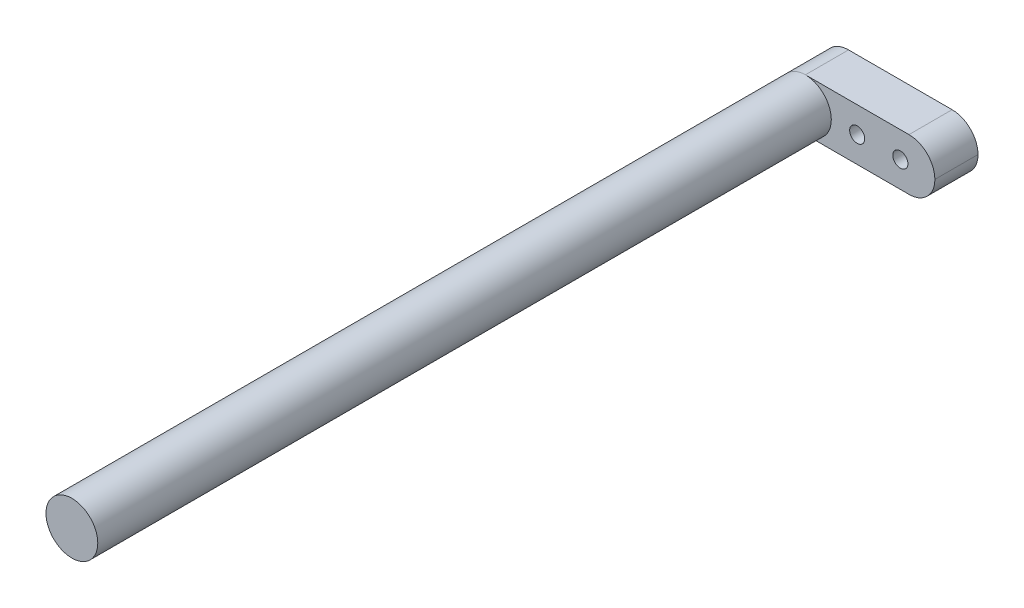
from build123d import *

# Parameters (mm, degrees)
SKETCH1_W           = 36
SKETCH1_H           = 12
BOSS_EXTRUDE1_DEPTH = 10
SKETCH2_R           = 6
BOSS_EXTRUDE2_DEPTH = 170
CUT_EXTRUDE4_REACH  = 184.748
SKETCH7_R           = 1.75
FILLET1_R           = 6


with BuildPart() as part:
    # Sketch1 → Boss-Extrude1 (new body)
    with BuildSketch(Plane.XY):
        with Locations((-13, 0)):
            Rectangle(SKETCH1_W, SKETCH1_H)
    extrude(amount=BOSS_EXTRUDE1_DEPTH)

    # Sketch2 → Boss-Extrude2 (add)
    with BuildSketch(Plane.XY.offset(10)):
        with Locations(Location((-25, 0, 0), (0, 0, 180))):
            Circle(SKETCH2_R)
    extrude(amount=BOSS_EXTRUDE2_DEPTH)

    # Sketch7 → Cut-Extrude4 (cut, up to next)
    with BuildSketch(Plane(origin=(0, 0, 0), x_dir=(-1, 0, 0), z_dir=(0, 0, -1)), mode=Mode.PRIVATE) as cut_extrude4_sk1:
        with Locations((3, 0)):
            Circle(SKETCH7_R)
    cut_extrude4_tool1 = extrude(cut_extrude4_sk1.sketch, amount=-CUT_EXTRUDE4_REACH, mode=Mode.PRIVATE) & part.part
    # Sketch7 → Cut-Extrude4 (cut, up to next)
    with BuildSketch(Plane(origin=(0, 0, 0), x_dir=(-1, 0, 0), z_dir=(0, 0, -1)), mode=Mode.PRIVATE) as cut_extrude4_sk2:
        with Locations((13, 0)):
            Circle(SKETCH7_R)
    cut_extrude4_tool2 = extrude(cut_extrude4_sk2.sketch, amount=-CUT_EXTRUDE4_REACH, mode=Mode.PRIVATE) & part.part
    add(cut_extrude4_tool1.solids().sort_by_distance((-3, 0, 0))[0], mode=Mode.SUBTRACT)
    add(cut_extrude4_tool2.solids().sort_by_distance((-13, 0, 0))[0], mode=Mode.SUBTRACT)

    # Fillet1
    fillet1_edges = [part.edges().sort_by_distance(p)[0] for p in [
        (5, -6, 5),
        (5, 6, 5),
        (-31, -6, 5),
        (-31, 6, 5),
    ]]
    fillet(fillet1_edges, radius=FILLET1_R - 0.0001)  # a hair under: the kernel refuses the full size


solid = part.part
